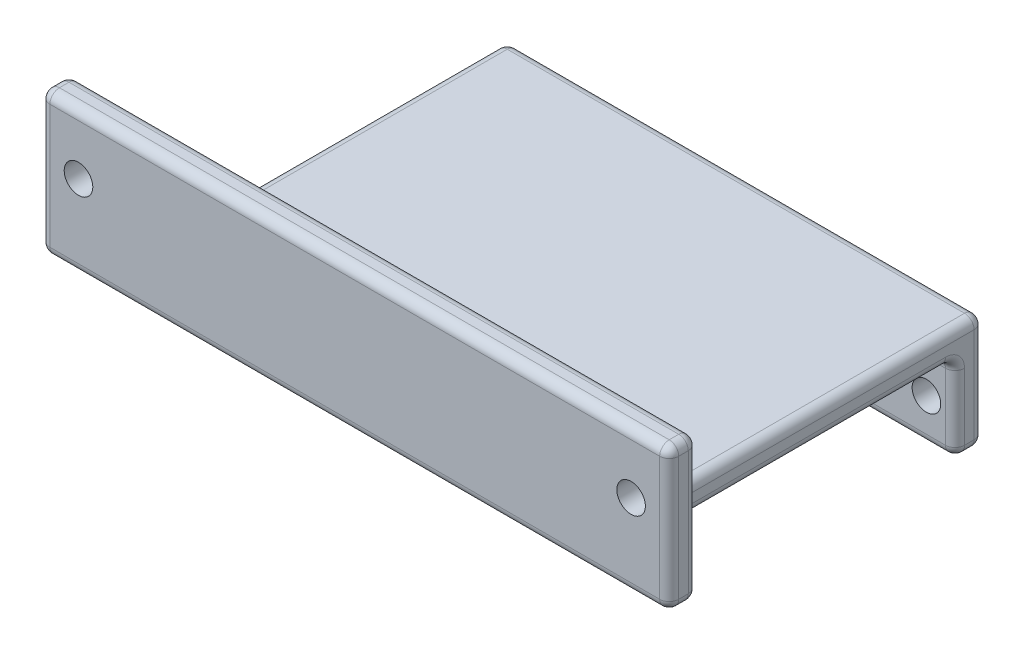
from build123d import *

# Parameters (mm, degrees)
SCHIZZO1_W                   = 50
SCHIZZO1_H                   = 12
ESTRUSIONE_ESTRUSIONE1_DEPTH = 3
SCHIZZO2_W                   = 50
SCHIZZO2_H                   = 3
ESTRUSIONE_ESTRUSIONE2_DEPTH = 35
SCHIZZO3_W                   = 66
SCHIZZO3_H                   = 15
ESTRUSIONE_ESTRUSIONE3_DEPTH = 3
SCHIZZO5_R                   = 1.5
TAGLIO_ESTRUSIONE1_DEPTH     = 6
SCHIZZO6_R                   = 1.5
TAGLIO_ESTRUSIONE2_DEPTH     = 6
RACCORDO1_R                  = 1


with BuildPart() as part:
    # Schizzo1 → Estrusione-Estrusione1 (new body)
    with BuildSketch(Plane.XY):
        Rectangle(SCHIZZO1_W, SCHIZZO1_H)
    extrude(amount=ESTRUSIONE_ESTRUSIONE1_DEPTH)

    # Schizzo2 → Estrusione-Estrusione2 (add)
    with BuildSketch(Plane.XY.offset(3)):
        with Locations((0, 4.5)):
            Rectangle(SCHIZZO2_W, SCHIZZO2_H)
    extrude(amount=ESTRUSIONE_ESTRUSIONE2_DEPTH)

    # Schizzo3 → Estrusione-Estrusione3 (add)
    with BuildSketch(Plane.XY.offset(38)):
        with Locations((0, 10.5)):
            Rectangle(SCHIZZO3_W, SCHIZZO3_H)
    extrude(amount=ESTRUSIONE_ESTRUSIONE3_DEPTH)

    # Schizzo5 → Taglio-Estrusione1 (cut)
    with BuildSketch(Plane.XY.offset(41)):
        with Locations((-29, 11.72)):
            Circle(SCHIZZO5_R)
        with Locations((29, 11.72)):
            Circle(SCHIZZO5_R)
    extrude(amount=-TAGLIO_ESTRUSIONE1_DEPTH, mode=Mode.SUBTRACT)

    # Schizzo6 → Taglio-Estrusione2 (cut)
    with BuildSketch(Plane(origin=(0, 0, 0), x_dir=(-1, 0, 0), z_dir=(0, 0, -1))):
        with Locations((-22, -1.5)):
            Circle(SCHIZZO6_R)
        with Locations((22, -1.5)):
            Circle(SCHIZZO6_R)
    extrude(amount=-TAGLIO_ESTRUSIONE2_DEPTH, mode=Mode.SUBTRACT)

    # Raccordo1
    raccordo1_edges = [part.edges().sort_by_distance(p)[0] for p in [
        (-25, 4.5, 38),
        (25, 4.5, 38),
        (29, 3, 38),
        (-29, 3, 38),
        (-25, 6, 19),
        (-25, 3, 20.5),
        (-25, -6, 1.5),
        (-25, -1.5, 3),
        (25, 3, 20.5),
        (25, 6, 19),
        (25, -6, 1.5),
        (0, -6, 3),
        (25, -1.5, 3),
        (25, 0, 0),
        (0, -6, 0),
        (-25, 0, 0),
        (0, 6, 0),
        (0, 3, 3),
        (0, 6, 38),
        (33, 10.5, 41),
        (33, 3, 39.5),
        (33, 10.5, 38),
        (33, 18, 39.5),
        (0, 18, 38),
        (0, 18, 41),
        (-33, 18, 39.5),
        (0, 3, 41),
        (-33, 3, 39.5),
        (-33, 10.5, 38),
        (-33, 10.5, 41),
    ]]
    fillet(raccordo1_edges, radius=RACCORDO1_R)


solid = part.part
